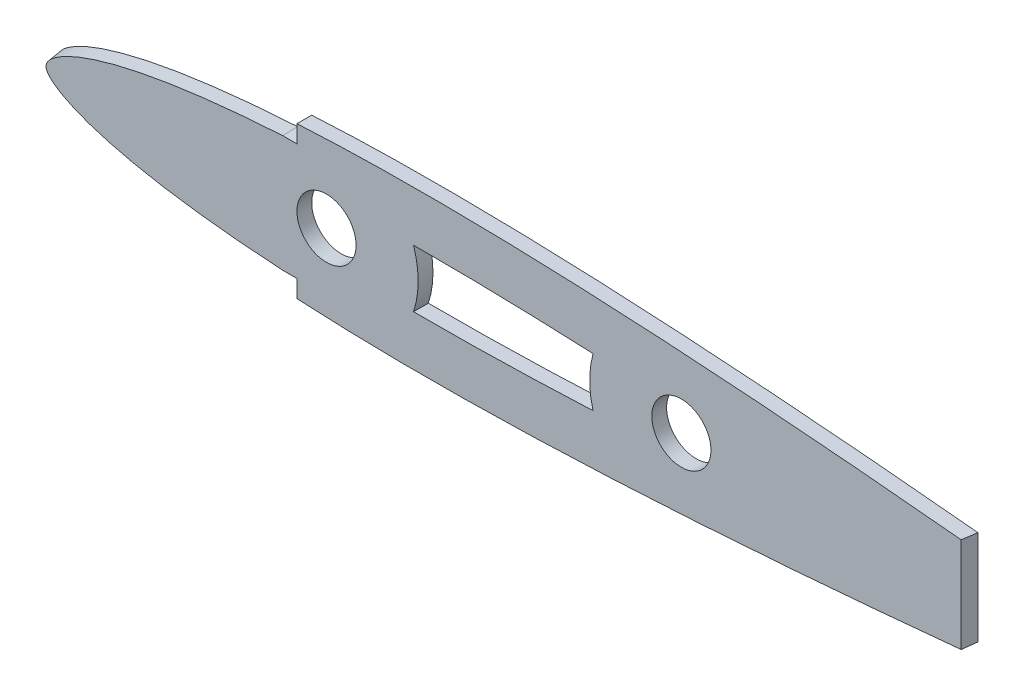
from build123d import *

# Parameters (mm, degrees)
BOSS_EXTRUDE1_DEPTH     = 3.175
SKETCH2_R               = 6.35
CUT_EXTRUDE1_DEPTH      = 3.175
CUT_EXTRUDE2_DEPTH      = 284.661185904
CUT_EXTRUDE2_DEPTH_BACK = 284.661185904
CUT_EXTRUDE3_DEPTH      = 7.62


with BuildPart() as part:
    # Sketch1 → Boss-Extrude1 (new body)
    with BuildSketch(Plane.XY):
        with BuildLine():
            add(Edge.make_bspline(
                [(283.0068, 0.356588568), (282.901747419, 0.44462405), (282.222988768, 0.361501496), (281.014292834, 0.701750535), (278.797705315, 0.912055534), (275.811625252, 1.363395917), (271.96510687, 1.867061556), (267.326448481, 2.487806401), (261.907718596, 3.189499382), (255.748156548, 3.970743632), (248.883761402, 4.817852882), (241.357474346, 5.719362844), (233.215556988, 6.664092103), (224.508147533, 7.639178426), (215.288960535, 8.632716794), (205.614900546, 9.632367333), (195.545587828, 10.625227013), (185.143130495, 11.597359066), (174.471591387, 12.536001404), (163.596880752, 13.425461607), (152.585818931, 14.251236992), (141.506392817, 14.997996378), (130.426867175, 15.650125673), (119.415450083, 16.19114965), (108.540147703, 16.606641404), (97.867696152, 16.883046032), (87.464049003, 17.006862886), (77.393132365, 16.968265808), (67.717036062, 16.75979946), (58.495320886, 16.376179449), (49.784748261, 15.816402284), (41.638853683, 15.082152298), (34.107484228, 14.179164014), (27.236546007, 13.115120527), (21.067675242, 11.901134861), (15.637028536, 10.550933877), (10.975465177, 9.077683717), (7.106668967, 7.49510566), (4.042977604, 5.813906592), (1.789105378, 4.030768344), (0.345518556, 2.10255275), (-0.161023932, 0), (0.345518556, -2.10255275), (1.789105378, -4.030768344), (4.042977604, -5.813906592), (7.106668967, -7.49510566), (10.975465177, -9.077683717), (15.637028536, -10.550933877), (21.067675242, -11.901134861), (27.236546007, -13.115120527), (34.107484228, -14.179164014), (41.638853683, -15.082152298), (49.784748261, -15.816402284), (58.495320886, -16.376179449), (67.717036062, -16.75979946), (77.393132365, -16.968265808), (87.464049003, -17.006862886), (97.867696152, -16.883046032), (108.540147703, -16.606641404), (119.415450083, -16.19114965), (130.426867175, -15.650125673), (141.506392817, -14.997996378), (152.585818931, -14.251236992), (163.596880752, -13.425461607), (174.471591387, -12.536001404), (185.143130495, -11.597359066), (195.545587828, -10.625227013), (205.614900546, -9.632367333), (215.288960535, -8.632716794), (224.508147533, -7.639178426), (233.215556988, -6.664092103), (241.357474346, -5.719362844), (248.883761402, -4.817852882), (255.748156548, -3.970743632), (261.907718596, -3.189499382), (267.326448481, -2.487806401), (271.96510687, -1.867061556), (275.811625252, -1.363395917), (278.797705315, -0.912055534), (281.014292834, -0.701750535), (282.222988768, -0.361501496), (283.176929529, -0.478323569), (283.176929529, 0.214017725), (283.0068, 0.356588568)],
                knots=[0, 0, 0, 0, 0.000762215, 0.003044706, 0.006832246, 0.012101176, 0.018817536, 0.026939455, 0.036414848, 0.047184628, 0.059180413, 0.072327874, 0.086544061, 0.10174058, 0.117823336, 0.134691452, 0.152240154, 0.17036129, 0.188941008, 0.207865435, 0.227016078, 0.246275696, 0.265524943, 0.284644966, 0.303520118, 0.322034575, 0.340078353, 0.357542593, 0.374325482, 0.390329891, 0.40546389, 0.419643801, 0.432793371, 0.444843817, 0.455737921, 0.465428653, 0.47388632, 0.481101634, 0.487101684, 0.491975368, 0.495930678, 0.499382808, 0.502834938, 0.506790248, 0.511663932, 0.517663982, 0.524879296, 0.533336963, 0.543027695, 0.553921799, 0.565972245, 0.579121815, 0.593301726, 0.608435725, 0.624440134, 0.641223023, 0.658687263, 0.676731041, 0.695245498, 0.71412065, 0.733240673, 0.75248992, 0.771749538, 0.790900181, 0.809824608, 0.828404326, 0.846525462, 0.864074164, 0.88094228, 0.897025036, 0.912221555, 0.926437743, 0.939585203, 0.951580988, 0.962350768, 0.971826162, 0.979948081, 0.986664441, 0.991933371, 0.99572091, 0.998003402, 0.998765616, 1, 1, 1, 1], degree=3))
        make_face()
    extrude(amount=BOSS_EXTRUDE1_DEPTH)

    # Sketch2 → Cut-Extrude1 (cut)
    with BuildSketch(Plane.XY.offset(3.175)):
        with Locations((63.5, 0)):
            Circle(SKETCH2_R)
        with Locations((139.7, 0)):
            Circle(SKETCH2_R)
    extrude(amount=-CUT_EXTRUDE1_DEPTH, mode=Mode.SUBTRACT)

    # Sketch3 → Cut-Extrude2 (cut, two sides: drawn at the far end of the back side and taken through both)
    with BuildSketch(Plane(origin=(0, 0, 0), x_dir=(1, 0, 0), z_dir=(0, 1, 0)).offset(-CUT_EXTRUDE2_DEPTH_BACK)):
        Polygon((280.502264678, 570.685147201), (200.220132014, 0), (199.773483328, -3.175), (283.134397147, -3.175), (283.134397147, 0), (283.134397147, 576.304397051), (-760.640477334, 1065.222635252), (-763.272609802, 1059.603385401), align=None)
    extrude(amount=CUT_EXTRUDE2_DEPTH + CUT_EXTRUDE2_DEPTH_BACK, mode=Mode.SUBTRACT)

    # Sketch5 → Cut-Loft1 section 0
    with BuildSketch(Plane.XY.offset(3.175)):
        with BuildLine():
            Line((57.15, -15.840717611), (57.15, -12.517848774))
            Line((57.15, -12.517848774), (54.102, -12.517848774))
            add(Edge.make_bspline(
                [(54.102, 12.517848774), (52.905073826, 12.446922239), (50.510877245, 12.29292233), (46.923042309, 12.02249839), (43.342906141, 11.709637993), (39.772343425, 11.350207554), (36.212958119, 10.940125109), (32.668672918, 10.473083309), (29.140579279, 9.942416236), (26.221744689, 9.439792705), (23.899631399, 8.996334016), (22.168124881, 8.641223297), (20.447130555, 8.261260302), (18.73921392, 7.85440932), (17.04583843, 7.418483842), (15.37131979, 6.950314461), (13.720374707, 6.446953018), (12.099093951, 5.903590986), (10.516736009, 5.316840777), (8.982942702, 4.676356823), (7.515425701, 3.975597981), (6.148367378, 3.214391725), (5.132435214, 2.525362189), (4.436328841, 1.942644965), (3.99449908, 1.50088383), (3.639558845, 1.055711416), (3.418173473, 0.67028204), (3.294529971, 0.303832168), (3.258254336, 8.98e-07), (3.294531501, -0.303834398), (3.41817022, -0.670279004), (3.63956519, -1.05571658), (3.994486701, -1.500874192), (4.436322379, -1.942640233), (5.13276687, -2.525613649), (6.148175252, -3.21424607), (7.515525046, -3.97567324), (8.982885795, -4.676313816), (10.516775422, -5.316870372), (12.099068229, -5.90357211), (13.720394844, -6.446967156), (15.371289631, -6.95029465), (17.045828606, -7.418477981), (18.739219111, -7.854412516), (20.44713727, -8.261264475), (22.168119663, -8.641219802), (23.899622625, -8.996332253), (26.221845214, -9.439810116), (29.140506404, -9.942404258), (32.668709943, -10.473088914), (36.212941173, -10.940123046), (39.772346311, -11.350206942), (43.342914131, -11.709640819), (46.923012021, -12.0224901), (50.510859023, -12.292917903), (52.905073826, -12.446922239), (54.102, -12.517848774)],
                knots=[0, 0, 0, 0, 0.03125, 0.0625, 0.09375, 0.125, 0.15625, 0.1875, 0.21875, 0.25, 0.265625, 0.28125, 0.296875, 0.3125, 0.328125, 0.34375, 0.359375, 0.375, 0.390625, 0.40625, 0.421875, 0.4375, 0.453125, 0.4609375, 0.46875, 0.4765625, 0.484375, 0.4921875, 0.5, 0.5078125, 0.515625, 0.5234375, 0.53125, 0.5390625, 0.546875, 0.5625, 0.578125, 0.59375, 0.609375, 0.625, 0.640625, 0.65625, 0.671875, 0.6875, 0.703125, 0.71875, 0.734375, 0.75, 0.78125, 0.8125, 0.84375, 0.875, 0.90625, 0.9375, 0.96875, 1, 1, 1, 1], degree=3))
            Line((54.102, 12.517848774), (57.15, 12.517848774))
            Line((57.15, 12.517848774), (57.15, 15.840717611))
            Line((57.15, 15.840717611), (57.15, 24.528656823))
            Line((57.15, 24.528656823), (-13.660315185, 32.196838039))
            Line((-13.660315185, 32.196838039), (4.751362513, -35.926369443))
            Line((4.751362513, -35.926369443), (57.15, -29.012871964))
            Line((57.15, -29.012871964), (57.15, -15.840717611))
        make_face()
    # Sketch4 → Cut-Loft1 section 1
    with BuildSketch(Plane(origin=(0, 0, 0), x_dir=(-1, 0, 0), z_dir=(0, 0, -1))):
        with BuildLine():
            Line((-57.15, -15.931097341), (-57.15, -12.614401813))
            Line((-57.15, -12.614401813), (-54.102, -12.614401813))
            add(Edge.make_bspline(
                [(-54.102, 12.614401813), (-52.892966304, 12.543650374), (-50.474562395, 12.389900929), (-46.850429349, 12.119518431), (-43.233994008, 11.80632974), (-39.627106768, 11.446155851), (-36.031309682, 11.034861155), (-32.450571185, 10.566087473), (-28.885974607, 10.033109549), (-25.936699002, 9.527992325), (-23.590171059, 9.082138578), (-21.840349809, 8.725010585), (-20.101018277, 8.342781179), (-18.374759552, 7.933393598), (-16.663038707, 7.494638099), (-14.970151675, 7.023265253), (-13.3008012, 6.516250081), (-11.661107617, 5.968693544), (-10.06037111, 5.377118947), (-8.508330893, 4.731019213), (-7.022897298, 4.023737888), (-5.63853584, 3.25470078), (-4.609088563, 2.55765795), (-3.903506054, 1.967798123), (-3.455598612, 1.52050909), (-3.095749955, 1.069692125), (-2.871302388, 0.679325256), (-2.745924545, 0.30796261), (-2.7091298, 9.1e-07), (-2.745926097, -0.307964873), (-2.871299087, -0.679322175), (-3.095756394, -1.069697364), (-3.455586055, -1.520499314), (-3.903499495, -1.967793321), (-4.609425021, -2.557913052), (-5.638340949, -3.254553026), (-7.022998045, -4.023814214), (-8.50827323, -4.730975626), (-10.060410962, -5.377148887), (-11.661081805, -5.968674575), (-13.300821123, -6.516264103), (-14.970122445, -7.02324602), (-16.6630295, -7.494632633), (-18.374764393, -7.933396571), (-20.10102481, -8.342785237), (-21.840344745, -8.725007186), (-23.590162295, -9.082136874), (-25.936800786, -9.528009858), (-28.88590077, -10.033097475), (-32.450608778, -10.56609314), (-36.031292313, -11.034859029), (-39.627110143, -11.446155342), (-43.234001329, -11.806332406), (-46.850400529, -12.119510514), (-50.474544843, -12.389896679), (-52.892966304, -12.543650374), (-54.102, -12.614401813)],
                knots=[0, 0, 0, 0, 0.03125, 0.0625, 0.09375, 0.125, 0.15625, 0.1875, 0.21875, 0.25, 0.265625, 0.28125, 0.296875, 0.3125, 0.328125, 0.34375, 0.359375, 0.375, 0.390625, 0.40625, 0.421875, 0.4375, 0.453125, 0.4609375, 0.46875, 0.4765625, 0.484375, 0.4921875, 0.5, 0.5078125, 0.515625, 0.5234375, 0.53125, 0.5390625, 0.546875, 0.5625, 0.578125, 0.59375, 0.609375, 0.625, 0.640625, 0.65625, 0.671875, 0.6875, 0.703125, 0.71875, 0.734375, 0.75, 0.78125, 0.8125, 0.84375, 0.875, 0.90625, 0.9375, 0.96875, 1, 1, 1, 1], degree=3))
            Line((-54.102, 12.614401813), (-57.15, 12.614401813))
            Line((-57.15, 12.614401813), (-57.15, 15.931097341))
            Line((-57.15, 15.931097341), (-57.15, 23.768946795))
            Line((-57.15, 23.768946795), (16.290986713, 29.461293478))
            Line((16.290986713, 29.461293478), (3.107394198, -36.097931887))
            Line((3.107394198, -36.097931887), (-57.15, -26.910981695))
            Line((-57.15, -26.910981695), (-57.15, -15.931097341))
        make_face()
    loft(mode=Mode.SUBTRACT)

    # Sketch6 → Cut-Extrude3 (cut)
    with BuildSketch(Plane(origin=(0, 0, 0), x_dir=(-1, 0, 0), z_dir=(0, 0, -1))):
        with BuildLine():
            ThreePointArc((-120.7436607, -5.30626284), (-120.015, 0), (-120.7436607, 5.30626284))
            add(Edge.make_bspline(
                [(-120.7436607, 5.30626284), (-116.113978677, 5.516834405), (-111.486849996, 5.695579464), (-101.374008891, 6.004242594), (-95.890716435, 6.118585943), (-87.671447186, 6.189682577), (-84.92815734, 6.19667575), (-82.188251061, 6.184536948)],
                knots=[0.519741838, 0.519741838, 0.519741838, 0.519741838, 0.625, 0.625, 0.75, 0.75, 0.812699407, 0.812699407, 0.812699407, 0.812699407], degree=3))
            ThreePointArc((-82.188251061, 6.184536948), (-83.185, 0), (-82.188251061, -6.184536948))
            add(Edge.make_bspline(
                [(-82.188251061, -6.184536948), (-84.92815734, -6.19667575), (-87.671447186, -6.189682577), (-95.890716436, -6.118585943), (-101.374008891, -6.004242594), (-111.486849996, -5.695579464), (-116.113978677, -5.516834405), (-120.7436607, -5.30626284)],
                knots=[0.187300593, 0.187300593, 0.187300593, 0.187300593, 0.25, 0.25, 0.375, 0.375, 0.480258162, 0.480258162, 0.480258162, 0.480258162], degree=3))
        make_face()
    extrude(amount=-CUT_EXTRUDE3_DEPTH, mode=Mode.SUBTRACT)


solid = part.part
